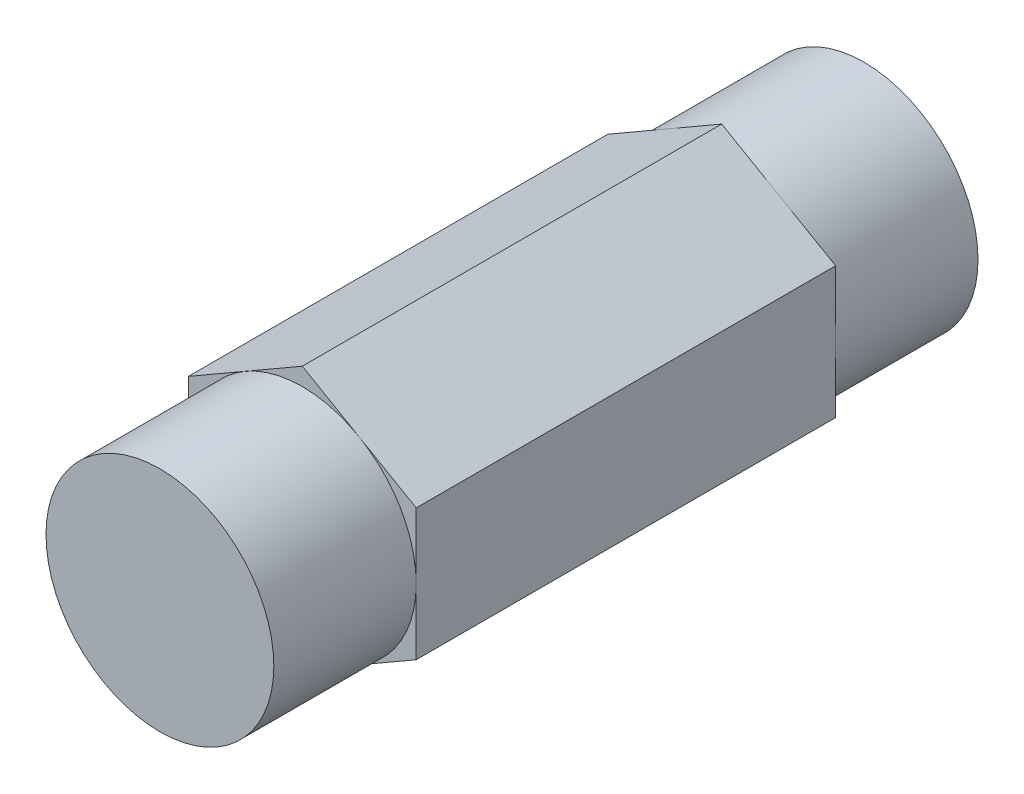
from build123d import *

# Parameters (mm, degrees)
BOSS_EXTRUDE1_DEPTH     = 19.62785
SKETCH2_R               = 8.89
SKETCH2_R_2             = 6.35
CUT_EXTRUDE_THIN1_DEPTH = 7.9375


with BuildPart() as part:
    # Sketch1 → Boss-Extrude1 (new, symmetric)
    with BuildSketch(Plane.XY):
        Polygon((0, 7.332348419), (-6.35, 3.666174209), (-6.35, -3.666174209), (0, -7.332348419), (6.35, -3.666174209), (6.35, 3.666174209), align=None)
    extrude(amount=BOSS_EXTRUDE1_DEPTH, both=True)

    # Sketch2 → Cut-Extrude-Thin1 (cut)
    with BuildSketch(Plane(origin=(0, 0, -19.62785), x_dir=(-1, 0, 0), z_dir=(0, 0, -1))):
        Circle(SKETCH2_R)
        Circle(SKETCH2_R_2, mode=Mode.SUBTRACT)
    cut_extrude_thin1 = extrude(amount=-CUT_EXTRUDE_THIN1_DEPTH, mode=Mode.SUBTRACT)

    # Mirror1: Cut-Extrude-Thin1 across plane
    add(cut_extrude_thin1.mirror(Plane.XY), mode=Mode.SUBTRACT)


solid = part.part
